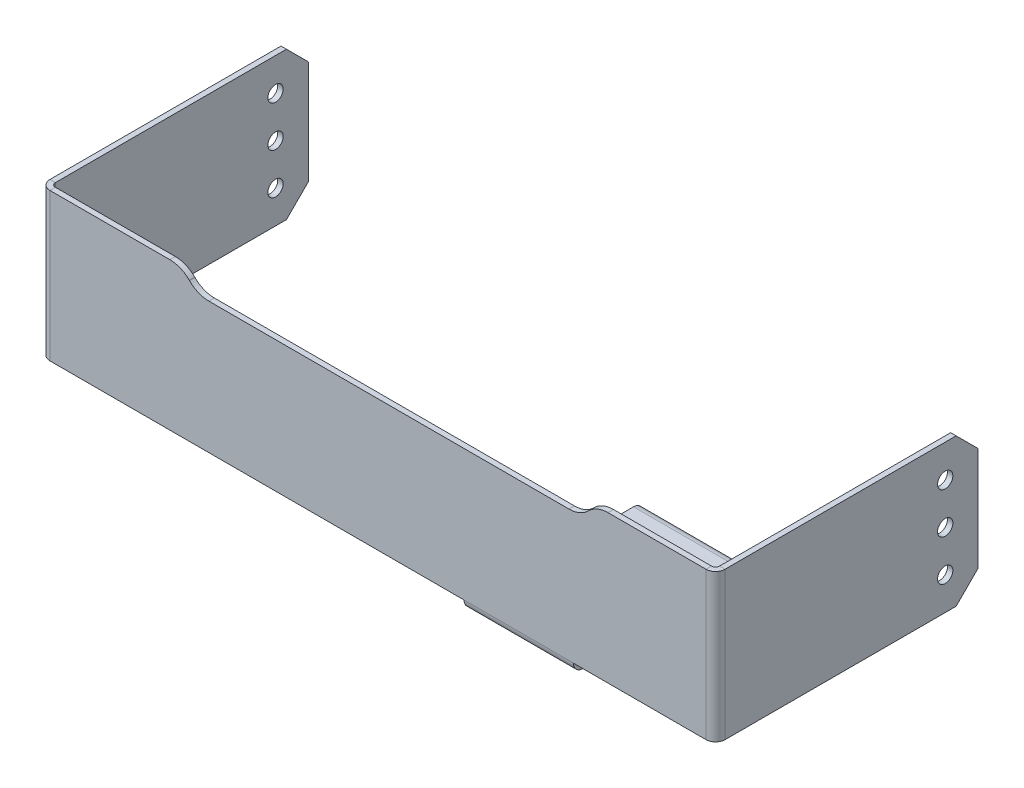
from build123d import *

# Parameters (mm, degrees)
BASE_FLANGE1_DEPTH = 1
EDGE_FLANGE1_DEPTH = 27
EDGE_FLANGE2_DEPTH = 27
EDGE_FLANGE3_DEPTH = 20
EDGE_FLANGE4_DEPTH = 20
SKETCH18_R         = 1.4
CUT_EXTRUDE1_DEPTH = 136.048103644
SKETCH19_R         = 1.4
CUT_EXTRUDE2_DEPTH = 75.642159258


# Sheet-metal steps are written as plain solids
with BuildPart() as part:
    # Sketch1 → Base-Flange1 (new body)
    with BuildSketch(Plane.XY):
        with BuildLine():
            Line((-30.928932188, 10.5), (34.928932188, 10.5))
            ThreePointArc((34.928932188, 10.5), (36.84234935, 10.880602337), (38.464466094, 11.964466094))
            Line((38.464466094, 11.964466094), (38.535533906, 12.035533906))
            ThreePointArc((38.535533906, 12.035533906), (40.15765065, 13.119397663), (42.071067812, 13.5))
            Line((42.071067812, 13.5), (60, 13.5))
            Line((60, 13.5), (60, -13.5))
            Line((60, -13.5), (-60, -13.5))
            Line((-60, -13.5), (-60, 13.5))
            Line((-60, 13.5), (-38.071067812, 13.5))
            ThreePointArc((-38.071067812, 13.5), (-36.15765065, 13.119397663), (-34.535533906, 12.035533906))
            Line((-34.535533906, 12.035533906), (-34.464466094, 11.964466094))
            ThreePointArc((-34.464466094, 11.964466094), (-32.84234935, 10.880602337), (-30.928932188, 10.5))
        make_face()
    extrude(amount=-BASE_FLANGE1_DEPTH)

    # Edge-Flange1 section (across the edge) → Edge-Flange1 (add)
    with BuildSketch(Plane(origin=(60.7366, 13.5, -1), x_dir=(-1, 0, 0), z_dir=(0, -1, 0))):
        with BuildLine():
            Line((-1, 0.7366), (-1, 47))
            Line((-1, 47), (0, 47))
            Line((0, 47), (0, 0.7366))
            ThreePointArc((0, 0.7366), (0.215745145, 0.215745145), (0.7366, 0))
            Line((0.7366, 0), (0.7366, -1))
            ThreePointArc((0.7366, -1), (-0.491361636, -0.491361636), (-1, 0.7366))
        make_face()
    extrude(amount=EDGE_FLANGE1_DEPTH)

    # Edge-Flange2 section (across the edge) → Edge-Flange2 (add)
    with BuildSketch(Plane(origin=(-60.7366, -13.5, -1), x_dir=(1, 0, 0), z_dir=(0, 1, 0))):
        with BuildLine():
            Line((-1, 0.7366), (-1, 47))
            Line((-1, 47), (0, 47))
            Line((0, 47), (0, 0.7366))
            ThreePointArc((0, 0.7366), (0.215745145, 0.215745145), (0.7366, 0))
            Line((0.7366, 0), (0.7366, -1))
            ThreePointArc((0.7366, -1), (-0.491361636, -0.491361636), (-1, 0.7366))
        make_face()
    extrude(amount=EDGE_FLANGE2_DEPTH)

    # Edge-Flange3 section (across the edge) → Edge-Flange3 (add)
    with BuildSketch(Plane(origin=(35.7366, -14.2366, -1), x_dir=(0, 1, 0), z_dir=(-1, 0, 0))):
        with BuildLine():
            Line((-1, 0.7366), (-1, 30))
            Line((-1, 30), (0, 30))
            Line((0, 30), (0, 0.7366))
            ThreePointArc((0, 0.7366), (0.215745145, 0.215745145), (0.7366, 0))
            Line((0.7366, 0), (0.7366, -1))
            ThreePointArc((0.7366, -1), (-0.491361636, -0.491361636), (-1, 0.7366))
        make_face()
    extrude(amount=EDGE_FLANGE3_DEPTH)

    # Edge-Flange4 section (across the edge) → Edge-Flange4 (add)
    with BuildSketch(Plane(origin=(15.7366, -15.2366, -31.7366), x_dir=(0, 0, 1), z_dir=(1, 0, 0))):
        with BuildLine():
            Line((-1, 0.7366), (-1, 11))
            Line((-1, 11), (0, 11))
            Line((0, 11), (0, 0.7366))
            ThreePointArc((0, 0.7366), (0.215745145, 0.215745145), (0.7366, 0))
            Line((0.7366, 0), (0.7366, -1))
            ThreePointArc((0.7366, -1), (-0.491361636, -0.491361636), (-1, 0.7366))
        make_face()
    extrude(amount=EDGE_FLANGE4_DEPTH)

    # Sketch18 → Cut-Extrude1 (cut, through all)
    with BuildSketch(Plane.ZY.offset(61.7366)):
        Polygon((-48, 9.5), (-44, 13.5), (-48, 13.5), align=None)
        Polygon((-48, -13.5), (-44, -13.5), (-48, -9.5), align=None)
        with Locations((-42, 7.5)):
            Circle(SKETCH18_R)
        with Locations((-42, 0)):
            Circle(SKETCH18_R)
        with Locations((-42, -7.5)):
            Circle(SKETCH18_R)
    extrude(amount=-CUT_EXTRUDE1_DEPTH, mode=Mode.SUBTRACT)

    # Sketch19 → Cut-Extrude2 (cut, through all)
    with BuildSketch(Plane(origin=(0, 0, -32.7366), x_dir=(-1, 0, 0), z_dir=(0, 0, -1))):
        with BuildLine():
            ThreePointArc((-15.7366, -20.2366), (-17.493959313, -24.479240687), (-21.7366, -26.2366))
            Line((-21.7366, -26.2366), (-15.7366, -26.2366))
            Line((-15.7366, -26.2366), (-15.7366, -20.2366))
        make_face()
        with BuildLine():
            ThreePointArc((-29.7366, -26.2366), (-33.979240687, -24.479240687), (-35.7366, -20.2366))
            Line((-35.7366, -20.2366), (-35.7366, -26.2366))
            Line((-35.7366, -26.2366), (-29.7366, -26.2366))
        make_face()
        with Locations((-30.7366, -22.2366)):
            Circle(SKETCH19_R)
        with Locations((-20.7366, -22.2366)):
            Circle(SKETCH19_R)
    extrude(amount=-CUT_EXTRUDE2_DEPTH, mode=Mode.SUBTRACT)


solid = part.part
